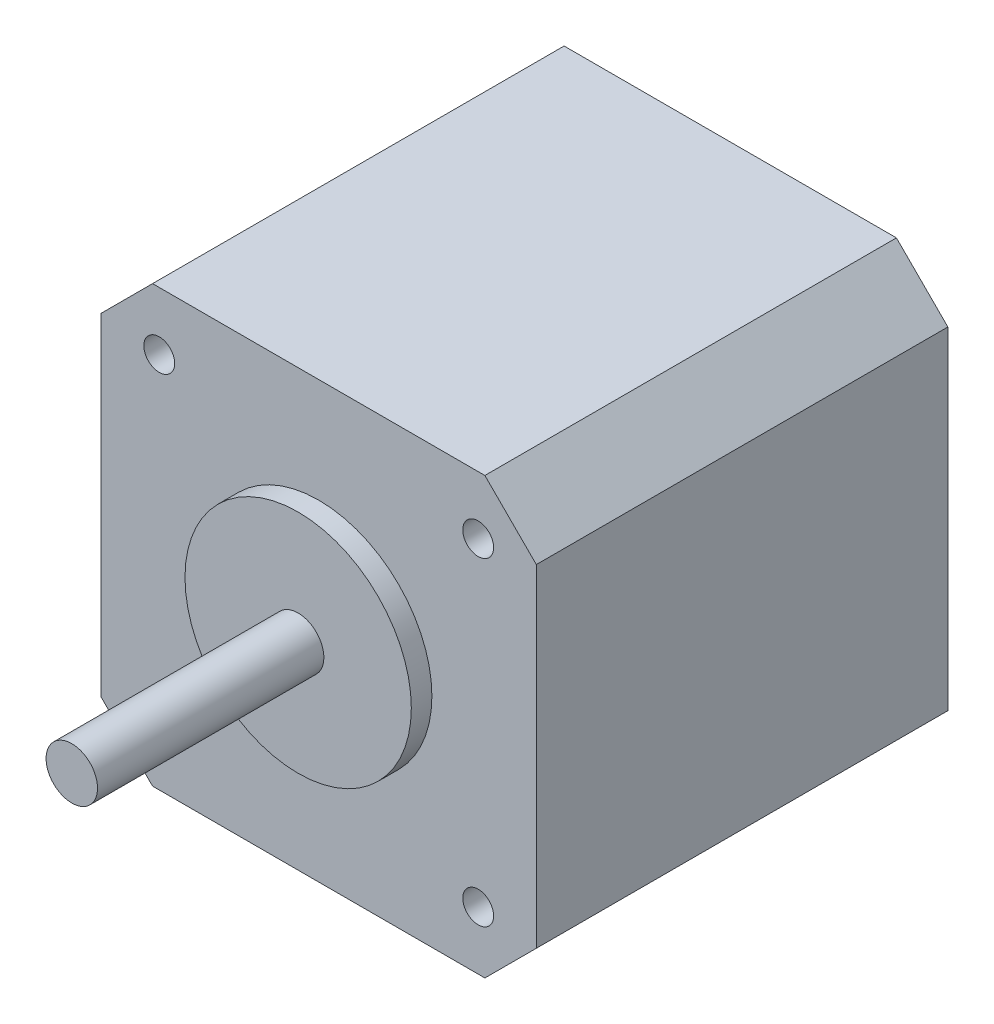
from build123d import *

# Parameters (mm, degrees)
SKETCH1_W           = 42.3
SKETCH1_H           = 42.3
BOSS_EXTRUDE1_DEPTH = 40
SKETCH2_R           = 11
BOSS_EXTRUDE2_DEPTH = 2
SKETCH3_R           = 2.5
BOSS_EXTRUDE3_DEPTH = 22
SKETCH4_R           = 1.5
CUT_EXTRUDE1_DEPTH  = 4.5
CHAMFER1_SIZE       = 5
SKETCH5_W           = 5
SKETCH5_H           = 5
BOSS_EXTRUDE4_DEPTH = 1


with BuildPart() as part:
    # Sketch1 → Boss-Extrude1 (new body)
    with BuildSketch(Plane.XY):
        Rectangle(SKETCH1_W, SKETCH1_H)
    extrude(amount=-BOSS_EXTRUDE1_DEPTH)

    # Sketch2 → Boss-Extrude2 (add)
    with BuildSketch(Plane.XY):
        Circle(SKETCH2_R)
    extrude(amount=BOSS_EXTRUDE2_DEPTH)

    # Sketch3 → Boss-Extrude3 (add)
    with BuildSketch(Plane.XY.offset(2)):
        Circle(SKETCH3_R)
    extrude(amount=BOSS_EXTRUDE3_DEPTH)

    # Sketch4 → Cut-Extrude1 (cut)
    with BuildSketch(Plane.XY):
        with Locations((-15.5, 15.5)):
            Circle(SKETCH4_R)
        with Locations((15.5, 15.5)):
            Circle(SKETCH4_R)
        with Locations((15.5, -15.5)):
            Circle(SKETCH4_R)
        with Locations((-15.5, -15.5)):
            Circle(SKETCH4_R)
    extrude(amount=-CUT_EXTRUDE1_DEPTH, mode=Mode.SUBTRACT)

    # Chamfer1
    chamfer1_edges = [part.edges().sort_by_distance(p)[0] for p in [
        (-21.15, -21.15, -20),
        (21.15, -21.15, -20),
        (21.15, 21.15, -20),
        (-21.15, 21.15, -20),
    ]]
    chamfer(chamfer1_edges, length=CHAMFER1_SIZE)

    # Sketch5 → Boss-Extrude4 (add)
    with BuildSketch(Plane.XZ.offset(21.15)):
        with Locations((0, -34.5)):
            Rectangle(SKETCH5_W, SKETCH5_H)
    extrude(amount=BOSS_EXTRUDE4_DEPTH)


solid = part.part
